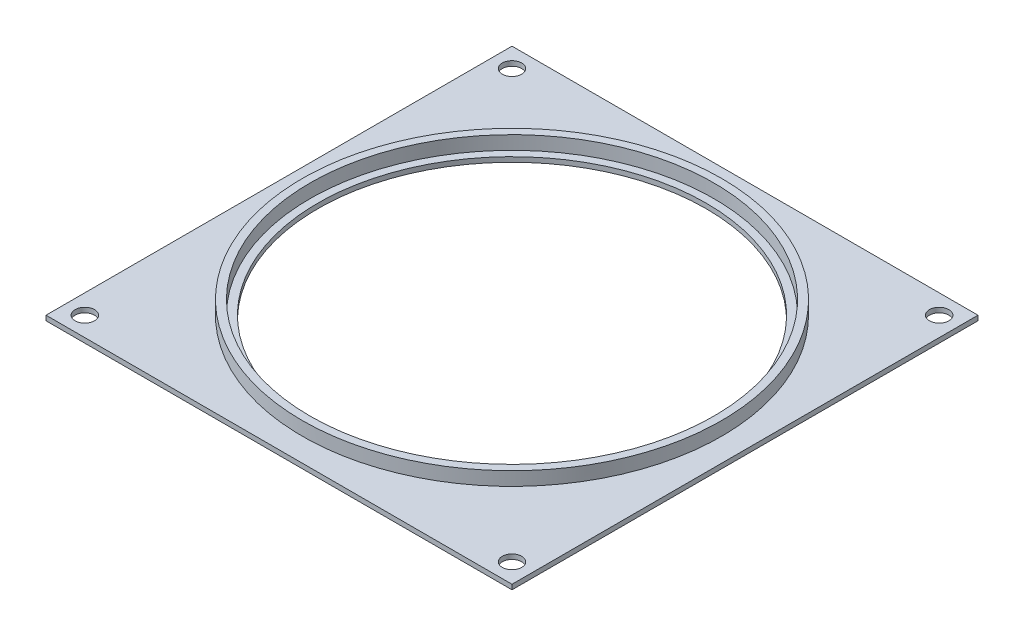
from build123d import *

# Parameters (mm, degrees)
SKETCH1_W           = 152.4
SKETCH1_H           = 152.4
SKETCH1_R           = 63.5
SKETCH1_R_2         = 3.175
BOSS_EXTRUDE1_DEPTH = 1.5875
SKETCH2_R           = 68.58
SKETCH2_R_2         = 66.04
BOSS_EXTRUDE2_DEPTH = 4.445


with BuildPart() as part:
    # Sketch1 → Boss-Extrude1 (new body)
    with BuildSketch(Plane(origin=(0, 0, 0), x_dir=(1, 0, 0), z_dir=(0, 1, 0))):
        Rectangle(SKETCH1_W, SKETCH1_H)
        Circle(SKETCH1_R, mode=Mode.SUBTRACT)
        with Locations((-69.85, 69.85)):
            Circle(SKETCH1_R_2, mode=Mode.SUBTRACT)
        with Locations((69.85, 69.85)):
            Circle(SKETCH1_R_2, mode=Mode.SUBTRACT)
        with Locations((69.85, -69.85)):
            Circle(SKETCH1_R_2, mode=Mode.SUBTRACT)
        with Locations((-69.85, -69.85)):
            Circle(SKETCH1_R_2, mode=Mode.SUBTRACT)
    extrude(amount=BOSS_EXTRUDE1_DEPTH)

    # Sketch2 → Boss-Extrude2 (add)
    with BuildSketch(Plane(origin=(0, 1.5875, 0), x_dir=(1, 0, 0), z_dir=(0, 1, 0))):
        Circle(SKETCH2_R)
        Circle(SKETCH2_R_2, mode=Mode.SUBTRACT)
    extrude(amount=BOSS_EXTRUDE2_DEPTH)


solid = part.part
